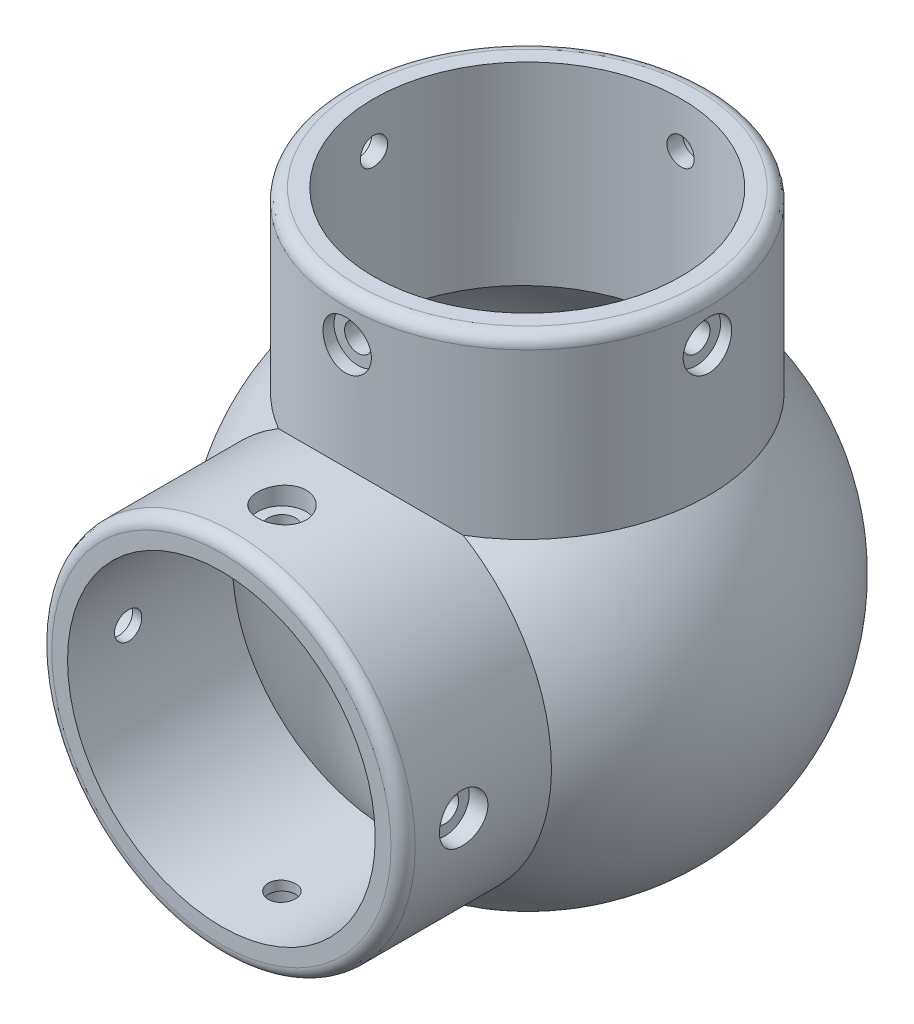
from build123d import *

# Parameters (mm, degrees)
BOSS_EXTRUDE1_START      = 25
SKETCH2_R                = 30
SKETCH2_R_2              = 25.4
BOSS_EXTRUDE1_DEPTH      = 25.5
BOSS_EXTRUDE2_START      = 25
SKETCH4_R                = 30
SKETCH4_R_2              = 25.4
BOSS_EXTRUDE2_DEPTH      = 30
SKETCH5_R                = 25.4
CUT_EXTRUDE1_DEPTH       = 55.88
SKETCH6_R                = 25.4
CUT_EXTRUDE2_DEPTH       = 50.8
CUT_EXTRUDE3_START       = -30.000000101
CUT_EXTRUDE3_OUTLINE_R   = 2.25
CUT_EXTRUDE3_DEPTH       = 4.699851959
CIRPATTERN1_COUNT        = 4
CUT_EXTRUDE4_START       = -20.087747132
CUT_EXTRUDE4_OUTLINE_R   = 4
CUT_EXTRUDE4_OUTLINE_R_2 = 2.25
CUT_EXTRUDE4_DEPTH       = 3.087747132
CIRPATTERN2_COUNT        = 4
CUT_EXTRUDE5_START       = -20.087747097
CUT_EXTRUDE5_OUTLINE_R   = 2.25
CUT_EXTRUDE5_DEPTH       = 4.699851949
CUT_EXTRUDE6_START       = -20.087747111
CUT_EXTRUDE6_OUTLINE_R   = 4
CUT_EXTRUDE6_OUTLINE_R_2 = 2.25
CUT_EXTRUDE6_DEPTH       = 2.087747111
CIRPATTERN3_COUNT        = 4
FILLET1_R                = 2


# Read off the part's stored shape, not the designer's step: Cut-Extrude3, Cut-Extrude4, Cut-Extrude5, Cut-Extrude6
with BuildPart() as part:
    # Sketch1 → Revolve3 (revolve)
    with BuildSketch(Plane.XY):
        with BuildLine():
            Line((-30.085321385, 0), (-25.085321385, 0))
            ThreePointArc((-25.085321385, 0), (9.904628787, 34.161318329), (44.894578959, 0))
            Line((44.894578959, 0), (49.909827328, 0))
            ThreePointArc((49.909827328, 0), (9.912252971, 39.559493915), (-30.085321385, 0))
        make_face()
    revolve(axis=Axis((44.894578959, 0, 0), (1, 0, 0)))

    # Sketch2 → Boss-Extrude1 (add)
    with BuildSketch(Plane.XY.offset(BOSS_EXTRUDE1_START)):
        with Locations((9.912252971, 0)):
            Circle(SKETCH2_R)
        with Locations(Location((9.912252971, 0, 0), (0, 0, 224.979340739))):
            Circle(SKETCH2_R_2, mode=Mode.SUBTRACT)
    extrude(amount=BOSS_EXTRUDE1_DEPTH)

    # Sketch4 → Boss-Extrude2 (add)
    with BuildSketch(Plane(origin=(0, 0, 0), x_dir=(1, 0, 0), z_dir=(0, 1, 0)).offset(BOSS_EXTRUDE2_START)):
        with Locations(Location((9.912252971, 0, 0), (0, 0, 300.540106599))):
            Circle(SKETCH4_R)
        with Locations(Location((9.912252971, 0, 0), (0, 0, 135.020659261))):
            Circle(SKETCH4_R_2, mode=Mode.SUBTRACT)
    extrude(amount=BOSS_EXTRUDE2_DEPTH)

    # Sketch5 → Cut-Extrude1 (cut)
    with BuildSketch(Plane.XY):
        with Locations((9.912252971, 0)):
            Circle(SKETCH5_R)
    extrude(amount=CUT_EXTRUDE1_DEPTH, mode=Mode.SUBTRACT)

    # Sketch6 → Cut-Extrude2 (cut)
    with BuildSketch(Plane(origin=(0, 0, 0), x_dir=(1, 0, 0), z_dir=(0, 1, 0))):
        with Locations(Location((9.912252971, 0, 0), (0, 0, 295.608500521))):
            Circle(SKETCH6_R)
    extrude(amount=CUT_EXTRUDE2_DEPTH, mode=Mode.SUBTRACT)

    # Cut-Extrude3 outline → Cut-Extrude3 (cut)
    with BuildSketch(Plane(origin=(0, 0, 0), x_dir=(1, 0, 0), z_dir=(0, 1, 0)).offset(CUT_EXTRUDE3_START)):
        with Locations((9.912252971, -40.5)):
            Circle(CUT_EXTRUDE3_OUTLINE_R)
    cut_extrude3 = extrude(amount=CUT_EXTRUDE3_DEPTH, mode=Mode.SUBTRACT)

    # CirPattern1: Cut-Extrude3 ×4 about axis
    cirpattern1_axis = Axis((9.912252971, 0, 50.5), (0, 0, 1))
    for i in range(1, CIRPATTERN1_COUNT):
        add(cut_extrude3.rotate(cirpattern1_axis, i * 360 / CIRPATTERN1_COUNT), mode=Mode.SUBTRACT)

    # Cut-Extrude4 outline → Cut-Extrude4 (cut)
    with BuildSketch(Plane(origin=(0, 0, 0), x_dir=(0, 0, -1), z_dir=(1, 0, 0)).offset(CUT_EXTRUDE4_START)):
        with Locations((-40.5, 0)):
            Circle(CUT_EXTRUDE4_OUTLINE_R)
        with Locations((-40.5, 0)):
            Circle(CUT_EXTRUDE4_OUTLINE_R_2, mode=Mode.SUBTRACT)
    cut_extrude4 = extrude(amount=CUT_EXTRUDE4_DEPTH, mode=Mode.SUBTRACT)

    # CirPattern2: Cut-Extrude4 ×4 about axis
    cirpattern2_axis = Axis((9.912252971, 0, 0), (0, 0, 1))
    for i in range(1, CIRPATTERN2_COUNT):
        add(cut_extrude4.rotate(cirpattern2_axis, i * 360 / CIRPATTERN2_COUNT), mode=Mode.SUBTRACT)

    # Cut-Extrude5 outline → Cut-Extrude5 (cut)
    with BuildSketch(Plane(origin=(0, 0, 0), x_dir=(0, 0, -1), z_dir=(1, 0, 0)).offset(CUT_EXTRUDE5_START)):
        with Locations((0, 47.5)):
            Circle(CUT_EXTRUDE5_OUTLINE_R)
    cut_extrude5 = extrude(amount=CUT_EXTRUDE5_DEPTH, mode=Mode.SUBTRACT)

    # Cut-Extrude6 outline → Cut-Extrude6 (cut)
    with BuildSketch(Plane(origin=(0, 0, 0), x_dir=(0, 0, -1), z_dir=(1, 0, 0)).offset(CUT_EXTRUDE6_START)):
        with Locations((0, 47.5)):
            Circle(CUT_EXTRUDE6_OUTLINE_R)
        with Locations((0, 47.5)):
            Circle(CUT_EXTRUDE6_OUTLINE_R_2, mode=Mode.SUBTRACT)
    cut_extrude6 = extrude(amount=CUT_EXTRUDE6_DEPTH, mode=Mode.SUBTRACT)

    # CirPattern3: Cut-Extrude5, Cut-Extrude6 ×4 about axis
    cirpattern3_axis = Axis((9.912252971, 0, 0), (0, 1, 0))
    add([cut_extrude5.rotate(cirpattern3_axis, i * 360 / CIRPATTERN3_COUNT) for i in range(1, CIRPATTERN3_COUNT)], mode=Mode.SUBTRACT)
    add([cut_extrude6.rotate(cirpattern3_axis, i * 360 / CIRPATTERN3_COUNT) for i in range(1, CIRPATTERN3_COUNT)], mode=Mode.SUBTRACT)

    # Fillet1
    fillet1_edges = [part.edges().sort_by_distance(p)[0] for p in [
        (-20.087747029, 0, 50.5),
        (-5.331988197, 55, -25.838210294),
    ]]
    fillet(fillet1_edges, radius=FILLET1_R)


solid = part.part
